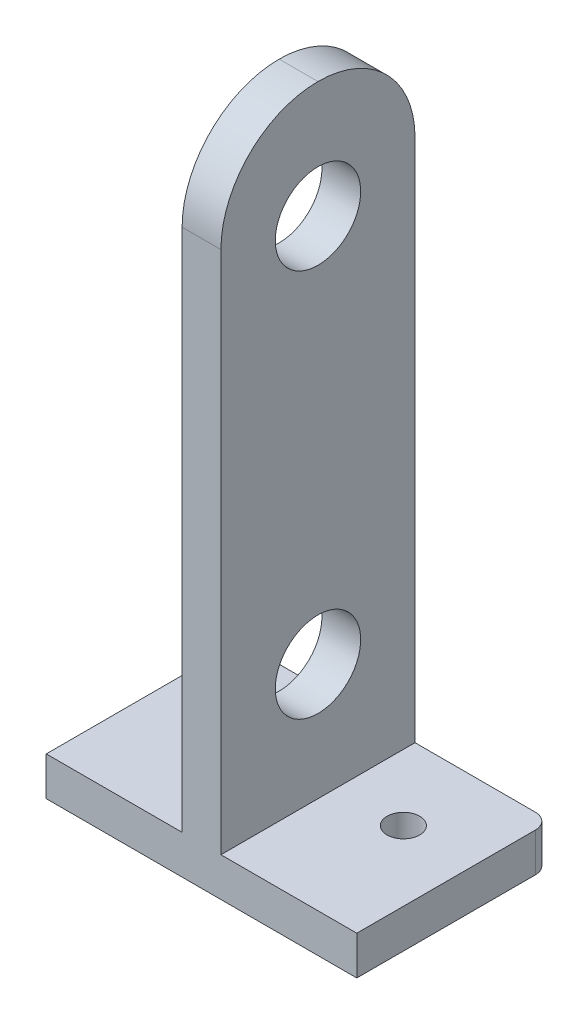
from build123d import *

# Parameters (mm, degrees)
SKETCH1_W           = 40
SKETCH1_H           = 25
BOSS_EXTRUDE1_DEPTH = 5
SKETCH3_W           = 5
SKETCH3_H           = 25
BOSS_EXTRUDE2_DEPTH = 80
SKETCH4_R           = 5.5
CUT_EXTRUDE1_DEPTH  = 92.412526494
SKETCH7_R           = 2.1
CUT_EXTRUDE2_DEPTH  = 93.870878105
FILLET1_R           = 12.5
FILLET2_R           = 2


with BuildPart() as part:
    # Sketch1 → Boss-Extrude1 (new body)
    with BuildSketch(Plane(origin=(0, 0, 0), x_dir=(1, 0, 0), z_dir=(0, 1, 0))):
        with Locations((20, -12.5)):
            Rectangle(SKETCH1_W, SKETCH1_H)
    extrude(amount=BOSS_EXTRUDE1_DEPTH)

    # Sketch3 → Boss-Extrude2 (add)
    with BuildSketch(Plane(origin=(0, 5, 0), x_dir=(1, 0, 0), z_dir=(0, 1, 0))):
        with Locations((20, -12.5)):
            Rectangle(SKETCH3_W, SKETCH3_H)
    extrude(amount=BOSS_EXTRUDE2_DEPTH)

    # Sketch4 → Cut-Extrude1 (cut, through all)
    with BuildSketch(Plane.ZY.offset(-17.5)):
        with Locations((12.5, 70)):
            Circle(SKETCH4_R)
        with Locations((12.5, 20)):
            Circle(SKETCH4_R)
    extrude(amount=-CUT_EXTRUDE1_DEPTH, mode=Mode.SUBTRACT)

    # Sketch7 → Cut-Extrude2 (cut, through all)
    with BuildSketch(Plane(origin=(0, 5, 0), x_dir=(1, 0, 0), z_dir=(0, 1, 0))):
        with Locations(Location((9, -10, 0), (0, 0, 270))):
            Circle(SKETCH7_R)
        with Locations(Location((31, -10, 0), (0, 0, 270))):
            Circle(SKETCH7_R)
    extrude(amount=-CUT_EXTRUDE2_DEPTH, mode=Mode.SUBTRACT)

    # Fillet1
    fillet1_edges = [part.edges().sort_by_distance(p)[0] for p in [
        (20, 85, 0),
        (20, 85, 25),
    ]]
    fillet(fillet1_edges, radius=FILLET1_R - 0.0001)  # a hair under: the kernel refuses the full size

    # Fillet2
    fillet2_edges = [part.edges().sort_by_distance(p)[0] for p in [
        (0, 2.5, 0),
        (40, 2.5, 0),
    ]]
    fillet(fillet2_edges, radius=FILLET2_R)


solid = part.part
